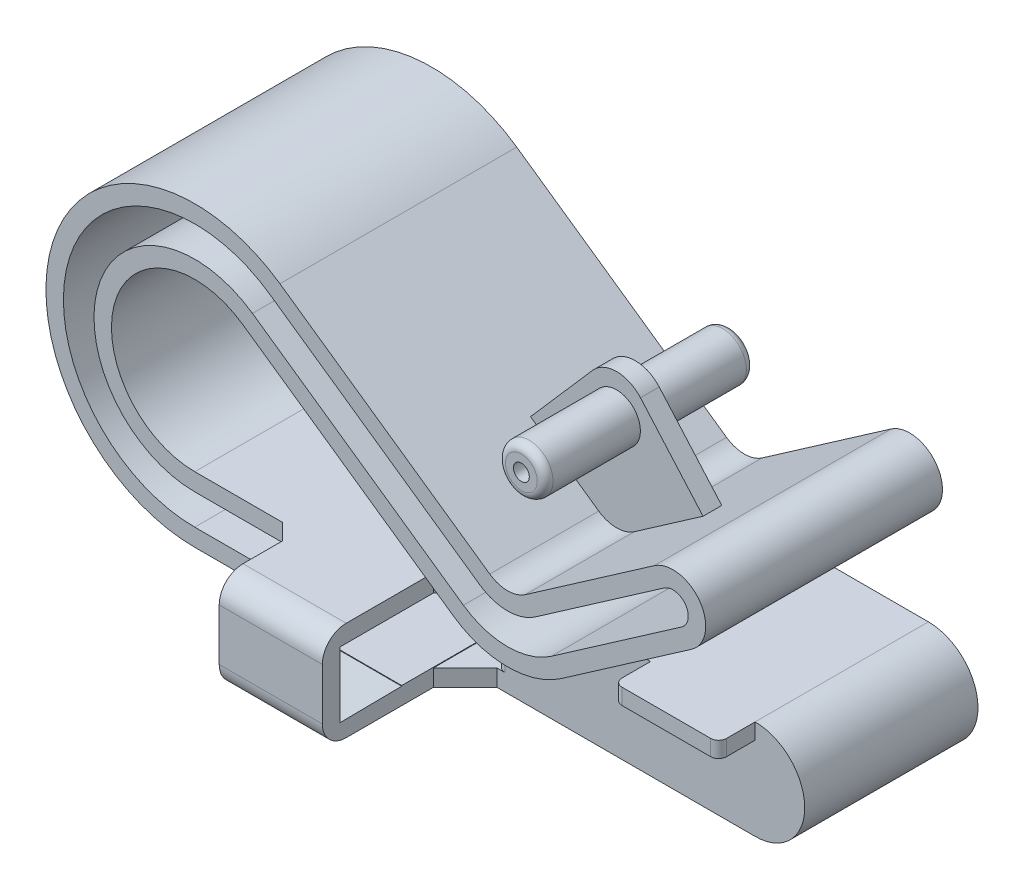
from build123d import *
from build123d.topology import SkipClean

# Parameters (mm, degrees)
BOSS_EXTRUDE2_DEPTH = 7.46
BOSS_EXTRUDE3_DEPTH = 0.59
SKETCH6_R           = 1.5
BOSS_EXTRUDE5_DEPTH = 6
BOSS_EXTRUDE6_START = 6
SKETCH7_R           = 1.5
BOSS_EXTRUDE6_DEPTH = 6
SKETCH8_R           = 0.5
CUT_EXTRUDE1_DEPTH  = 6
FILLET1_R           = 0.5
CUT_EXTRUDE2_START  = -6
SKETCH9_R           = 0.5
CUT_EXTRUDE2_DEPTH  = 6
FILLET2_R           = 0.5
CUT_EXTRUDE3_DEPTH  = 4
SKETCH12_W          = 6.5
SKETCH12_H          = 6.248148488
BOSS_EXTRUDE7_DEPTH = 5
SKETCH13_W          = 6.59
SKETCH13_H          = 1
BOSS_EXTRUDE8_DEPTH = 2.3
FILLET3_R           = 0.5
FILLET4_R           = 0.5
SHELL5_START        = -1.46
SHELL5_DEPTH        = 8.92
SHELL5_2_DEPTH      = 3.82
SHELL5_START_2      = 7.46
SHELL5_3_OUTLINE_W  = 4.3
SHELL5_3_OUTLINE_H  = 4.048148488
SHELL5_3_DEPTH      = 3.9
SHELL5_START_3      = 2.36
SHELL5_4_OUTLINE_W  = 2
SHELL5_4_OUTLINE_H  = 4.048148488
SHELL5_4_DEPTH      = 4
CUT_EXTRUDE4_DEPTH  = 10
FILLET5_R           = 1.5
FILLET6_R           = 1.5
CHAMFER2_SIZE       = 1
CHAMFER3_SIZE       = 1
SKETCH17_W          = 2
SKETCH17_H          = 4.087488316
CUT_EXTRUDE5_DEPTH  = 17
SKETCH18_W          = 1.1
SKETCH18_H          = 4.048148488
CUT_EXTRUDE6_DEPTH  = 2
CHAMFER4_SIZE       = 4
FILLET7_R           = 0.5
SHELL9_START        = -7.46
SHELL9_DEPTH        = 4.9
CUT_EXTRUDE7_DEPTH  = 5
CUT_EXTRUDE8_DEPTH  = 5
SKETCH24_W          = 1.1
SKETCH24_H          = 4.048148488
CUT_EXTRUDE9_DEPTH  = 5
SKETCH25_W          = 1.1
SKETCH25_H          = 4.048148488
CUT_EXTRUDE10_DEPTH = 5
CUT_EXTRUDE11_DEPTH = 5
CUT_EXTRUDE12_DEPTH = 5
CUT_EXTRUDE13_DEPTH = 5
CHAMFER5_SIZE       = 4


# Read off the part's stored shape, not the designer's step: Shell5, Shell9
with BuildPart() as part:
    # Sketch1 → Boss-Extrude2 (new, symmetric)
    with BuildSketch(Plane.XY):
        with BuildLine():
            Line((0, 0), (25.73, 0))
            ThreePointArc((25.73, 0), (28.855, 3.125), (25.73, 6.25))
            Line((25.73, 6.25), (18.8, 6.25))
            ThreePointArc((18.8, 6.25), (14.130356731, 4.449999786), (9.460000184, 6.248148488))
            Line((9.460000184, 6.248148488), (-5.579999816, 6.248148488))
            ThreePointArc((-5.579999816, 6.248148488), (-10.588662374, 13.074184644), (-2.574295287, 15.803908151))
            Line((-2.574295287, 15.803908151), (10.717390583, 6.524156616))
            ThreePointArc((10.717390583, 6.524156616), (14.122000147, 5.451067533), (17.52911284, 6.516182343))
            Line((17.52911284, 6.516182343), (25.73, 12.213217424))
            ThreePointArc((25.73, 12.213217424), (26.24704842, 15.08315483), (23.377111014, 15.60020325))
            Line((23.377111014, 15.60020325), (15.252125086, 9.955895634))
            ThreePointArc((15.252125086, 9.955895634), (14.129296564, 9.604882504), (13.007292958, 9.958523589))
            Line((13.007292958, 9.958523589), (-0.211890331, 19.187656569))
            ThreePointArc((-0.211890331, 19.187656569), (-14.525339827, 14.312441954), (-5.579999816, 2.121320344))
            Line((-5.579999816, 2.121320344), (-2.121320344, 2.121320344))
            Line((-2.121320344, 2.121320344), (0, 0))
        make_face()
    extrude(amount=BOSS_EXTRUDE2_DEPTH, both=True)

    # Sketch4 → Boss-Extrude3 (add, symmetric)
    with BuildSketch(Plane.XY):
        with BuildLine():
            Line((19.577361072, 12.960573135), (15.636847625, 17.455604109))
            ThreePointArc((15.636847625, 17.455604109), (14.130533117, 18.137199105), (12.625846669, 17.452017503))
            Line((12.625846669, 17.452017503), (8.707361072, 12.960573135))
            Line((8.707361072, 12.960573135), (13.007292958, 9.958523589))
            ThreePointArc((13.007292958, 9.958523589), (14.129296564, 9.604882504), (15.252125086, 9.955895634))
            Line((15.252125086, 9.955895634), (19.577361072, 12.960573135))
        make_face()
    extrude(amount=BOSS_EXTRUDE3_DEPTH, both=True)

    # Sketch6 → Boss-Extrude5 (add)
    with BuildSketch(Plane.XY.offset(0.59)):
        with Locations((14.130170803, 15.637199105)):
            Circle(SKETCH6_R)
    extrude(amount=BOSS_EXTRUDE5_DEPTH)

    # Sketch7 → Boss-Extrude6 (add)
    with BuildSketch(Plane(origin=(0, 0, -0.59), x_dir=(-1, 0, 0), z_dir=(0, 0, -1)).offset(BOSS_EXTRUDE6_START)):
        with Locations(Location((-14.130170803, 15.637199105, 0), (0, 0, 180))):
            Circle(SKETCH7_R)
    extrude(amount=-BOSS_EXTRUDE6_DEPTH)

    # Sketch8 → Cut-Extrude1 (cut)
    with BuildSketch(Plane(origin=(0, 0, -6.59), x_dir=(-1, 0, 0), z_dir=(0, 0, -1))):
        with Locations((-14.130170803, 15.637199105)):
            Circle(SKETCH8_R)
    extrude(amount=-CUT_EXTRUDE1_DEPTH, mode=Mode.SUBTRACT)

    # Fillet1
    fillet1_edges = [part.edges().sort_by_distance(p)[0] for p in [
        (12.630170803, 15.637199105, -6.59),
    ]]
    fillet(fillet1_edges, radius=FILLET1_R)

    # Sketch9 → Cut-Extrude2 (cut)
    with BuildSketch(Plane.XY.offset(6.59).offset(CUT_EXTRUDE2_START)):
        with Locations(Location((14.130170803, 15.637199105, 0), (0, 0, 180))):
            Circle(SKETCH9_R)
    extrude(amount=CUT_EXTRUDE2_DEPTH, mode=Mode.SUBTRACT)

    # Fillet2
    fillet2_edges = [part.edges().sort_by_distance(p)[0] for p in [
        (12.630170803, 15.637199105, 6.59),
    ]]
    fillet(fillet2_edges, radius=FILLET2_R)

    # Sketch11 → Cut-Extrude3 (cut)
    with BuildSketch(Plane.XY.offset(7.46)):
        with BuildLine():
            Line((9.460000184, 6.248148488), (9.460000184, 0))
            Line((9.460000184, 0), (25.73, 0))
            ThreePointArc((25.73, 0), (28.855, 3.125), (25.73, 6.25))
            Line((25.73, 6.25), (18.8, 6.25))
            ThreePointArc((18.8, 6.25), (14.130356731, 4.449999786), (9.460000184, 6.248148488))
        make_face()
    extrude(amount=-CUT_EXTRUDE3_DEPTH, mode=Mode.SUBTRACT)

    # Sketch12 → Boss-Extrude7 (add)
    with BuildSketch(Plane.XY.offset(7.46)):
        with Locations((4.210000184, 3.124074244)):
            Rectangle(SKETCH12_W, SKETCH12_H)
    extrude(amount=BOSS_EXTRUDE7_DEPTH)

    # Sketch13 → Boss-Extrude8 (add)
    with BuildSketch(Plane.XY.offset(3.46)):
        with Locations((22.435, 5.75)):
            Rectangle(SKETCH13_W, SKETCH13_H)
    extrude(amount=BOSS_EXTRUDE8_DEPTH)

    # Fillet3
    fillet3_edges = [part.edges().sort_by_distance(p)[0] for p in [
        (25.73, 5.75, 5.76),
    ]]
    fillet(fillet3_edges, radius=FILLET3_R)

    # Fillet4
    fillet4_edges = [part.edges().sort_by_distance(p)[0] for p in [
        (19.14, 5.75, 5.76),
    ]]
    fillet(fillet4_edges, radius=FILLET4_R)

    # Shell5 outline → Shell5 (cut)
    with BuildSketch(Plane.XY.offset(SHELL5_START)):
        with BuildLine():
            Line((6.360000184, 1.1), (6.360000184, 5.148148488))
            Line((6.360000184, 5.148148488), (-5.579999816, 5.148148488))
            ThreePointArc((-5.579999816, 5.148148488), (-11.637977986, 13.404240317), (-1.944599705, 16.705841338))
            Line((-1.944599705, 16.705841338), (11.347086166, 7.426089803))
            ThreePointArc((11.347086166, 7.426089803), (14.123287882, 6.55106678), (16.901530711, 7.419587386))
            Line((16.901530711, 7.419587386), (25.102417871, 13.116622467))
            ThreePointArc((25.102417871, 13.116622467), (25.343643378, 14.455572701), (24.004693143, 14.696798207))
            Line((24.004693143, 14.696798207), (15.879707215, 9.052490591))
            ThreePointArc((15.879707215, 9.052490591), (14.128008829, 8.504883258), (12.377597376, 9.056590402))
            Line((12.377597376, 9.056590402), (-0.841585914, 18.285723382))
            ThreePointArc((-0.841585914, 18.285723382), (-13.476024215, 13.98238628), (-5.579999816, 3.221320344))
            Line((-5.579999816, 3.221320344), (-1.665685425, 3.221320344))
            Line((-1.665685425, 3.221320344), (0.455634919, 1.1))
            Line((0.455634919, 1.1), (6.360000184, 1.1))
        make_face()
    extrude(amount=SHELL5_DEPTH, mode=Mode.SUBTRACT)

    # Shell5 2 outline → Shell5 2 (cut)
    with BuildSketch(Plane.XY.offset(SHELL5_START)):
        with BuildLine():
            ThreePointArc((25.73, 1.1), (27.755, 3.125), (25.73, 5.15))
            Line((25.73, 5.15), (19.206225915, 5.15))
            ThreePointArc((19.206225915, 5.15), (14.130446951, 3.349999783), (9.054011773, 5.148148488))
            Line((9.054011773, 5.148148488), (6.360000184, 5.148148488))
            Line((6.360000184, 5.148148488), (6.360000184, 1.1))
            Line((6.360000184, 1.1), (25.73, 1.1))
        make_face()
    extrude(amount=SHELL5_2_DEPTH, mode=Mode.SUBTRACT)

    # Shell5 3 outline → Shell5 3 (cut)
    with BuildSketch(Plane.XY.offset(SHELL5_START_2)):
        with Locations((4.210000184, 3.124074244)):
            Rectangle(SHELL5_3_OUTLINE_W, SHELL5_3_OUTLINE_H)
    extrude(amount=SHELL5_3_DEPTH, mode=Mode.SUBTRACT)

    # Shell5 4 outline → Shell5 4 (cut)
    with BuildSketch(Plane.XY.offset(SHELL5_START_3)):
        with Locations((7.360000184, 3.124074244)):
            Rectangle(SHELL5_4_OUTLINE_W, SHELL5_4_OUTLINE_H)
    extrude(amount=SHELL5_4_DEPTH, mode=Mode.SUBTRACT)

    # Sketch16 → Cut-Extrude4 (cut)
    with BuildSketch(Plane.ZY.offset(-0.960000184)):
        Polygon((7.93704162, 5.148148488), (11.36, 5.148148488), (11.36, 1.014676652), (7.46, 1.060660172), (7.46, 5.148148488), align=None)
    extrude(amount=-CUT_EXTRUDE4_DEPTH, mode=Mode.SUBTRACT)

    # Fillet5
    fillet5_edges = [part.edges().sort_by_distance(p)[0] for p in [
        (4.210000184, 6.248148488, 12.46),
    ]]
    fillet(fillet5_edges, radius=FILLET5_R)

    # Fillet6
    fillet6_edges = [part.edges().sort_by_distance(p)[0] for p in [
        (4.210000184, 0, 12.46),
    ]]
    fillet(fillet6_edges, radius=FILLET6_R)

    # Chamfer2
    chamfer2_edges = [part.edges().sort_by_distance(p)[0] for p in [
        (0.960000184, 5.698148488, 7.46),
    ]]
    chamfer(chamfer2_edges, length=CHAMFER2_SIZE)

    # Chamfer3
    chamfer3_edges = [part.edges().sort_by_distance(p)[0] for p in [
        (0.960000184, 0.530330086, 7.46),
    ]]
    chamfer(chamfer3_edges, length=CHAMFER3_SIZE)

    # Sketch17 → Cut-Extrude5 (cut)
    with BuildSketch(Plane.XY.offset(7.46)):
        with Locations((8.460000184, 3.10440433)):
            Rectangle(SKETCH17_W, SKETCH17_H)
    extrude(amount=-CUT_EXTRUDE5_DEPTH, mode=Mode.SUBTRACT)

    # Sketch18 → Cut-Extrude6 (cut)
    with BuildSketch(Plane(origin=(7.460000184, 0, 0), x_dir=(0, 0, -1), z_dir=(1, 0, 0))):
        with Locations((-6.91, 3.124074244)):
            Rectangle(SKETCH18_W, SKETCH18_H)
    extrude(amount=-CUT_EXTRUDE6_DEPTH, mode=Mode.SUBTRACT)

    # Chamfer4
    # the kernel refuses this chamfer: 4 mm, written as the material it takes off along each edge
    with BuildSketch(Plane(origin=(9.460000184, 11.347392124, 7.46), x_dir=(0.027495876610586487, 0, -0.9996219169112968), z_dir=(0, -1, 0))) as chamfer4_piece_1_section:
        Polygon((CHAMFER4_SIZE * 0.999621916911, -CHAMFER4_SIZE * 0.0274958766106), (-CHAMFER4_SIZE * 0.0274958766106, -CHAMFER4_SIZE * 0.999621916911), (0, 0), align=None)
    chamfer4_piece_1 = extrude(amount=21.634124076, mode=Mode.PRIVATE)
    chamfer4_piece_1 = split(chamfer4_piece_1, bisect_by=Plane(origin=(7.460000184, 0.530330086, 5.904444444), z_dir=(1, 0, 0)), keep=Keep.TOP, mode=Mode.PRIVATE)
    chamfer4_piece_1 = split(chamfer4_piece_1, bisect_by=Plane(origin=(8.571111295, 1.078924912, 5.910912732), z_dir=(0, -0.9999304975787501, -0.011789826627795805)), keep=Keep.TOP, mode=Mode.PRIVATE)
    add(chamfer4_piece_1, mode=Mode.SUBTRACT)

    # Fillet7
    fillet7_edges = [part.edges().sort_by_distance(p)[0] for p in [
        (9.460000184, 3.10440433, 3.46),
    ]]
    fillet(fillet7_edges, radius=FILLET7_R)

    # Shell9 outline → Shell9 (cut)
    with BuildSketch(Plane.XY.offset(SHELL9_START)):
        with BuildLine():
            Line((0.455634919, 1.1), (6.360000184, 1.1))
            Line((6.360000184, 1.1), (6.360000184, 5.148148488))
            Line((6.360000184, 5.148148488), (-5.579999816, 5.148148488))
            ThreePointArc((-5.579999816, 5.148148488), (-11.637977986, 13.404240317), (-1.944599705, 16.705841338))
            Line((-1.944599705, 16.705841338), (11.347086166, 7.426089803))
            ThreePointArc((11.347086166, 7.426089803), (14.123287882, 6.55106678), (16.901530711, 7.419587386))
            Line((16.901530711, 7.419587386), (25.102417871, 13.116622467))
            ThreePointArc((25.102417871, 13.116622467), (25.343643378, 14.455572701), (24.004693143, 14.696798207))
            Line((24.004693143, 14.696798207), (15.879707215, 9.052490591))
            ThreePointArc((15.879707215, 9.052490591), (14.128008829, 8.504883258), (12.377597376, 9.056590402))
            Line((12.377597376, 9.056590402), (-0.841585914, 18.285723382))
            ThreePointArc((-0.841585914, 18.285723382), (-13.476024215, 13.98238628), (-5.579999816, 3.221320344))
            Line((-5.579999816, 3.221320344), (-1.665685425, 3.221320344))
            Line((-1.665685425, 3.221320344), (0.455634919, 1.1))
        make_face()
        with BuildLine():
            Line((10.560000184, 1.1), (25.73, 1.1))
            ThreePointArc((25.73, 1.1), (27.755, 3.125), (25.73, 5.15))
            Line((25.73, 5.15), (19.206225915, 5.15))
            ThreePointArc((19.206225915, 5.15), (15.024752468, 3.399927605), (10.560000184, 4.183164872))
            Line((10.560000184, 4.183164872), (10.560000184, 1.1))
        make_face()
    extrude(amount=SHELL9_DEPTH, mode=Mode.SUBTRACT)

    # Sketch20 → Cut-Extrude7 (cut)
    with BuildSketch(Plane(origin=(0, 0, -2.56), x_dir=(-1, 0, 0), z_dir=(0, 0, -1))):
        with BuildLine():
            Line((-19.206225915, 5.15), (-25.73, 5.15))
            ThreePointArc((-25.73, 5.15), (-27.755, 3.125), (-25.73, 1.1))
            Line((-25.73, 1.1), (-10.560000184, 1.1))
            Line((-10.560000184, 1.1), (-10.560000184, 4.183164872))
            ThreePointArc((-10.560000184, 4.183164872), (-15.024752468, 3.399927605), (-19.206225915, 5.15))
        make_face()
    extrude(amount=-CUT_EXTRUDE7_DEPTH, mode=Mode.SUBTRACT)

    # Sketch23 → Cut-Extrude8 (cut)
    with BuildSketch(Plane(origin=(0, 0, -2.56), x_dir=(-1, 0, 0), z_dir=(0, 0, -1))):
        Polygon((-6.360000184, 5.148148488), (-6.360000184, 1.1), (-0.455634919, 1.1), (-0.390000184, 5.148148488), align=None)
    extrude(amount=-CUT_EXTRUDE8_DEPTH, mode=Mode.SUBTRACT)

    # Sketch24 → Cut-Extrude9 (cut)
    with BuildSketch(Plane(origin=(0, 0, -7.46), x_dir=(-1, 0, 0), z_dir=(0, 0, -1))):
        with Locations((-6.910000184, 3.124074244)):
            Rectangle(SKETCH24_W, SKETCH24_H)
    extrude(amount=-CUT_EXTRUDE9_DEPTH, mode=Mode.SUBTRACT)

    # Sketch25 → Cut-Extrude10 (cut)
    with BuildSketch(Plane(origin=(0, 0, -2.46), x_dir=(-1, 0, 0), z_dir=(0, 0, -1))):
        with Locations((-6.910000184, 3.124074244)):
            Rectangle(SKETCH25_W, SKETCH25_H)
    extrude(amount=-CUT_EXTRUDE10_DEPTH, mode=Mode.SUBTRACT)

    # Sketch27 → Cut-Extrude11 (cut)
    with SkipClean():  # the faces are left unmerged after this step: merging them gives an invalid solid
        with BuildSketch(Plane(origin=(0, 0, -2.56), x_dir=(-1, 0, 0), z_dir=(0, 0, -1))):
            with BuildLine():
                Line((0.841585914, 18.285723382), (1.944599705, 16.705841338))
                ThreePointArc((1.944599705, 16.705841338), (11.637977986, 13.404240317), (5.579999816, 5.148148488))
                Line((5.579999816, 5.148148488), (-0.390000184, 5.148148488))
                Line((-0.390000184, 5.148148488), (-0.455634919, 1.1))
                Line((-0.455634919, 1.1), (1.665685425, 3.221320344))
                Line((1.665685425, 3.221320344), (5.579999816, 3.221320344))
                ThreePointArc((5.579999816, 3.221320344), (13.476024215, 13.982386281), (0.841585914, 18.285723382))
            make_face()
        extrude(amount=-CUT_EXTRUDE11_DEPTH, mode=Mode.SUBTRACT)
    add(part.part.scale(1), mode=Mode.REPLACE)  # the faces are merged on a copy

    # Sketch28 → Cut-Extrude12 (cut)
    with BuildSketch(Plane(origin=(0, 0, -7.46), x_dir=(-1, 0, 0), z_dir=(0, 0, -1))):
        Polygon((-10.560000184, 4.183164872), (-10.560000184, 1.1), (-9.460000184, 1.060660172), (-9.460000184, 5.148148488), align=None)
    extrude(amount=-CUT_EXTRUDE12_DEPTH, mode=Mode.SUBTRACT)

    # Sketch29 → Cut-Extrude13 (cut)
    with BuildSketch(Plane(origin=(0, 0, -2.46), x_dir=(-1, 0, 0), z_dir=(0, 0, -1))):
        Polygon((-9.460000184, 1.060660172), (-9.460000184, 5.148148488), (-10.560000184, 4.183164872), (-10.560000184, 1.1), align=None)
    extrude(amount=-CUT_EXTRUDE13_DEPTH, mode=Mode.SUBTRACT)

    # Chamfer5
    # the kernel refuses this chamfer: 4 mm, written as the material it takes off along each edge
    with BuildSketch(Plane(origin=(9.460000184, 6.248148488, 7.46), x_dir=(-0.9996219169112968, 0, 0.027495876610586275), z_dir=(0, -1, 0))) as chamfer5_piece_1_section:
        Polygon((CHAMFER5_SIZE * 0.999621916911, CHAMFER5_SIZE * 0.0274958766106), (-CHAMFER5_SIZE * 0.0274958766106, CHAMFER5_SIZE * 0.999621916911), (0, 0), align=None)
    chamfer5_piece_1 = extrude(amount=11.386731952, mode=Mode.PRIVATE)
    chamfer5_piece_1 = split(chamfer5_piece_1, bisect_by=Plane(origin=(7.460000184, 5.698148488, 5.904444444), z_dir=(1, 0, 0)), keep=Keep.TOP, mode=Mode.PRIVATE)
    add(chamfer5_piece_1, mode=Mode.SUBTRACT)


solid = part.part
